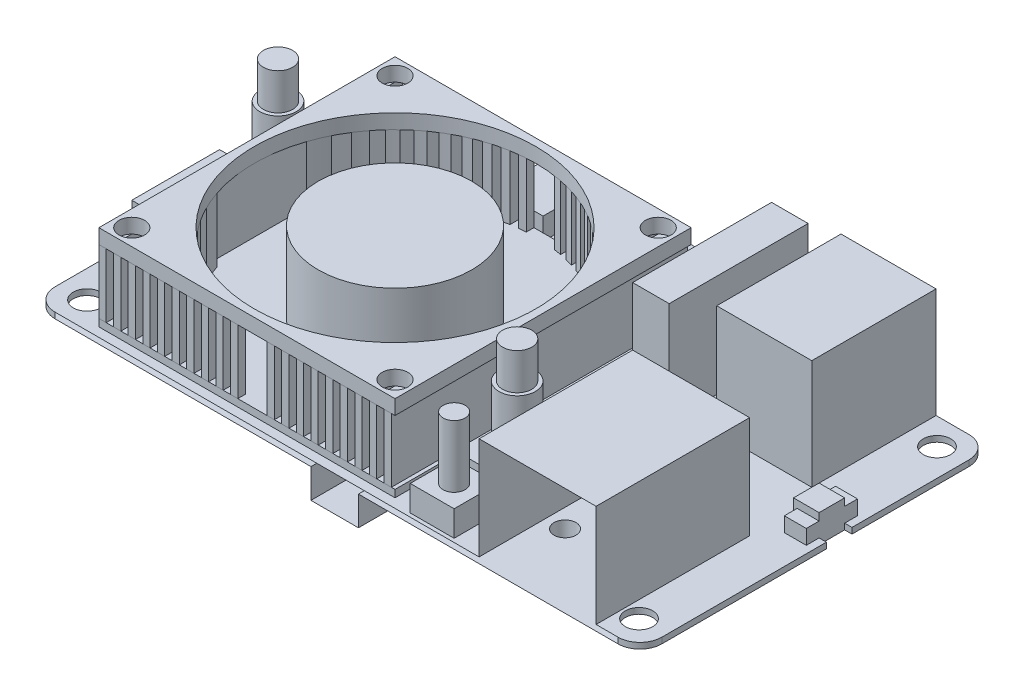
from build123d import *

# Parameters (mm, degrees)
SKETCH1_W                      = 83
SKETCH1_H                      = 48
SKETCH1_R                      = 1.875
BOSS_EXTRUDE1_DEPTH            = 0.8
FILLET1_R                      = 3
BOSS_EXTRUDE2_START            = 11
SKETCH2_R                      = 1.75
SKETCH2_R_2                    = 19.25
BOSS_EXTRUDE2_DEPTH            = 2
SKETCH2_3_W                    = 13
SKETCH2_3_H                    = 17
BOSS_EXTRUDE3_DEPTH            = 15
SKETCH2_4_W                    = 16
SKETCH2_4_H                    = 21
BOSS_EXTRUDE4_DEPTH            = 14
SKETCH2_5_W                    = 5
SKETCH2_5_H                    = 19
BOSS_EXTRUDE5_DEPTH            = 14
SKETCH2_6_R                    = 1.5
BOSS_EXTRUDE6_DEPTH            = 12
SKETCH2_7_W                    = 6
SKETCH2_7_H                    = 6
SKETCH2_7_R                    = 1.5
BOSS_EXTRUDE7_DEPTH            = 3.5
SKETCH2_8_W                    = 7
SKETCH2_8_H                    = 4.25
SKETCH2_8_H_2                  = 0.75
BOSS_EXTRUDE8_DEPTH            = 2.5
SKETCH2_9_W                    = 6.5
SKETCH2_9_H                    = 6.25
SKETCH2_9_H_2                  = 0.75
BOSS_EXTRUDE9_DEPTH            = 3
SKETCH2_10_W                   = 5
SKETCH2_10_H                   = 7.5
BOSS_EXTRUDE10_DEPTH           = 3.5
BOSS_EXTRUDE11_START           = 1.25
BOSS_EXTRUDE11_DEPTH           = 1
BOSS_EXTRUDE12_START           = 2.25
SKETCH2_12_R                   = 2.5
SKETCH2_12_R_2                 = 2
BOSS_EXTRUDE12_DEPTH           = 9
BOSS_EXTRUDE14_START           = 2.25
SKETCH2_13_R                   = 2
BOSS_EXTRUDE14_DEPTH           = 14
BOSS_EXTRUDE15_DEPTH           = 3
SKETCH2_15_W                   = 1
SKETCH2_15_H                   = 3.5
CUT_EXTRUDE1_DEPTH             = 3
SKETCH2_16_W                   = 3
SKETCH2_16_H                   = 1.75
BOSS_EXTRUDE16_DEPTH           = 2
SKETCH2_17_W                   = 2
SKETCH2_17_H                   = 1.75
BOSS_EXTRUDE17_DEPTH           = 2
BOSS_EXTRUDE18_DEPTH           = 6
SKETCH2_19_W                   = 5.06789321
SKETCH2_19_H                   = 12
BOSS_EXTRUDE19_DEPTH           = 5.5
CHAMFER1_SIZE                  = 1
BOSS_EXTRUDE23_DEPTH           = 8.75
BOSS_EXTRUDE23_2_DEPTH         = 8.75
BOSS_EXTRUDE23_3_DEPTH         = 8.75
BOSS_EXTRUDE23_4_DEPTH         = 8.75
BOSS_EXTRUDE23_5_DEPTH         = 8.75
BOSS_EXTRUDE23_6_DEPTH         = 8.75
BOSS_EXTRUDE23_7_DEPTH         = 8.75
BOSS_EXTRUDE23_8_DEPTH         = 8.75
BOSS_EXTRUDE23_9_DEPTH         = 8.75
BOSS_EXTRUDE23_10_DEPTH        = 8.75
BOSS_EXTRUDE23_11_DEPTH        = 8.75
BOSS_EXTRUDE23_12_DEPTH        = 8.75
BOSS_EXTRUDE23_13_DEPTH        = 8.75
BOSS_EXTRUDE23_14_DEPTH        = 8.75
BOSS_EXTRUDE23_15_DEPTH        = 8.75
BOSS_EXTRUDE23_16_DEPTH        = 8.75
BOSS_EXTRUDE23_17_DEPTH        = 8.75
BOSS_EXTRUDE23_18_DEPTH        = 8.75
BOSS_EXTRUDE23_19_DEPTH        = 8.75
BOSS_EXTRUDE23_20_DEPTH        = 8.75
BOSS_EXTRUDE23_21_DEPTH        = 8.75
BOSS_EXTRUDE23_22_DEPTH        = 8.75
BOSS_EXTRUDE23_23_DEPTH        = 8.75
BOSS_EXTRUDE23_24_DEPTH        = 8.75
BOSS_EXTRUDE23_25_DEPTH        = 8.75
BOSS_EXTRUDE23_26_DEPTH        = 8.75
BOSS_EXTRUDE23_27_DEPTH        = 8.75
BOSS_EXTRUDE23_28_DEPTH        = 8.75
BOSS_EXTRUDE23_29_DEPTH        = 8.75
BOSS_EXTRUDE23_30_DEPTH        = 8.75
BOSS_EXTRUDE23_31_DEPTH        = 8.75
BOSS_EXTRUDE23_32_DEPTH        = 8.75
BOSS_EXTRUDE23_33_DEPTH        = 8.75
BOSS_EXTRUDE23_34_DEPTH        = 8.75
BOSS_EXTRUDE23_35_DEPTH        = 8.75
BOSS_EXTRUDE23_36_DEPTH        = 8.75
BOSS_EXTRUDE24_START           = 2.25
SKETCH2_20_R                   = 10.5
BOSS_EXTRUDE24_DEPTH           = 11
SKETCH4_W                      = 4.5
SKETCH4_H                      = 8.5
BOSS_EXTRUDE25_DEPTH           = 4.5
SKETCH4_3_W                    = 11
SKETCH4_3_H                    = 5
BOSS_EXTRUDE26_DEPTH           = 3
SKETCH4_4_W                    = 11
SKETCH4_4_H                    = 13
BOSS_EXTRUDE27_DEPTH           = 2.5
SKETCH4_5_W                    = 13
SKETCH4_5_H                    = 18
SKETCH4_5_W_2                  = 11
SKETCH4_5_H_2                  = 13
BOSS_EXTRUDE28_DEPTH           = 2
SKETCH4_6_W                    = 6.5
SKETCH4_6_H                    = 13
BOSS_EXTRUDE29_DEPTH           = 4
SKETCH4_7_R                    = 1.5
BOSS_EXTRUDE30_DEPTH           = 4
BOSS_EXTRUDE30_DRAFT           = 5
BOSS_EXTRUDE30_PROFILE_2_DEPTH = 4
BOSS_EXTRUDE30_PROFILE_2_DRAFT = 5
SKETCH4_8_R                    = 1.5
BOSS_EXTRUDE31_DEPTH           = 2
BOSS_EXTRUDE31_DRAFT           = 5
BOSS_EXTRUDE31_PROFILE_2_DEPTH = 2
BOSS_EXTRUDE31_PROFILE_2_DRAFT = 5


with BuildPart() as part:
    # Sketch1 → Boss-Extrude1 (new body)
    with BuildSketch(Plane(origin=(0, 0, 0), x_dir=(1, 0, 0), z_dir=(0, 1, 0))):
        with Locations((-41.5, 24)):
            Rectangle(SKETCH1_W, SKETCH1_H)
        with Locations(Location((-79.25, 44.375, 0), (0, 0, 270))):
            Circle(SKETCH1_R, mode=Mode.SUBTRACT)
        with Locations(Location((-79.25, 3.625, 0), (0, 0, 270))):
            Circle(SKETCH1_R, mode=Mode.SUBTRACT)
        with Locations(Location((-3.75, 44.375, 0), (0, 0, 270))):
            Circle(SKETCH1_R, mode=Mode.SUBTRACT)
        with Locations(Location((-3.75, 3.625, 0), (0, 0, 270))):
            Circle(SKETCH1_R, mode=Mode.SUBTRACT)
    extrude(amount=BOSS_EXTRUDE1_DEPTH)

    # Fillet1
    fillet1_edges = [part.edges().sort_by_distance(p)[0] for p in [
        (0, 0.4, 0),
        (-83, 0.4, 0),
        (-83, 0.4, -48),
        (0, 0.4, -48),
    ]]
    fillet(fillet1_edges, radius=FILLET1_R)

    # Sketch2<3> → Boss-Extrude3 (add)
    with BuildSketch(Plane(origin=(0, 0.8, 0), x_dir=(1, 0, 0), z_dir=(0, 1, 0))):
        with Locations((-14, 39.5)):
            Rectangle(SKETCH2_3_W, SKETCH2_3_H)
    extrude(amount=BOSS_EXTRUDE3_DEPTH)

    # Sketch2<4> → Boss-Extrude4 (add)
    with BuildSketch(Plane(origin=(0, 0.8, 0), x_dir=(1, 0, 0), z_dir=(0, 1, 0))):
        with Locations((-14, 10.5)):
            Rectangle(SKETCH2_4_W, SKETCH2_4_H)
    extrude(amount=BOSS_EXTRUDE4_DEPTH)

    # Sketch2<5> → Boss-Extrude5 (add)
    with BuildSketch(Plane(origin=(0, 0.8, 0), x_dir=(1, 0, 0), z_dir=(0, 1, 0))):
        with Locations((-27.5, 38.5)):
            Rectangle(SKETCH2_5_W, SKETCH2_5_H)
    extrude(amount=BOSS_EXTRUDE5_DEPTH)

    # Sketch2<6> → Boss-Extrude6 (add)
    with BuildSketch(Plane(origin=(0, 0.8, 0), x_dir=(1, 0, 0), z_dir=(0, 1, 0))):
        with Locations(Location((-28.917074657, 3.5, 0), (0, 0, 90))):
            Circle(SKETCH2_6_R)
    extrude(amount=BOSS_EXTRUDE6_DEPTH)

    # Sketch2<7> → Boss-Extrude7 (add)
    with BuildSketch(Plane(origin=(0, 0.8, 0), x_dir=(1, 0, 0), z_dir=(0, 1, 0))):
        with Locations((-28.917074657, 3.5)):
            Rectangle(SKETCH2_7_W, SKETCH2_7_H)
        with Locations(Location((-28.917074657, 3.5, 0), (0, 0, 270))):
            Circle(SKETCH2_7_R, mode=Mode.SUBTRACT)
    extrude(amount=BOSS_EXTRUDE7_DEPTH)

    # Sketch2<8> → Boss-Extrude8 (add)
    with BuildSketch(Plane(origin=(0, 0.8, 0), x_dir=(1, 0, 0), z_dir=(0, 1, 0))):
        with Locations((-72, 45.875)):
            Rectangle(SKETCH2_8_W, SKETCH2_8_H)
        with Locations((-72, 48.375)):
            Rectangle(SKETCH2_8_W, SKETCH2_8_H_2)
    extrude(amount=BOSS_EXTRUDE8_DEPTH)

    # Sketch2<9> → Boss-Extrude9 (add)
    with BuildSketch(Plane(origin=(0, 0.8, 0), x_dir=(1, 0, 0), z_dir=(0, 1, 0))):
        with Locations((-58.25, 44.875)):
            Rectangle(SKETCH2_9_W, SKETCH2_9_H)
        with Locations((-58.25, 48.375)):
            Rectangle(SKETCH2_9_W, SKETCH2_9_H_2)
    extrude(amount=BOSS_EXTRUDE9_DEPTH)

    # Sketch2<10> → Boss-Extrude10 (add)
    with BuildSketch(Plane(origin=(0, 0.8, 0), x_dir=(1, 0, 0), z_dir=(0, 1, 0))):
        with Locations((-39.5, 44.25)):
            Rectangle(SKETCH2_10_W, SKETCH2_10_H)
    extrude(amount=BOSS_EXTRUDE10_DEPTH)

    # Sketch2<11> → Boss-Extrude11 (add)
    with BuildSketch(Plane(origin=(0, 0.8, 0), x_dir=(1, 0, 0), z_dir=(0, 1, 0)).offset(BOSS_EXTRUDE11_START)):
        with BuildLine():
            Line((-74, 40.5), (-74, 32.5))
            Line((-74, 32.5), (-78.5, 32.5))
            ThreePointArc((-78.5, 32.5), (-82, 29), (-78.5, 25.5))
            Line((-78.5, 25.5), (-74, 25.5))
            Line((-74, 25.5), (-74, 0))
            Line((-74, 0), (-33.5, 0))
            Line((-33.5, 0), (-33.5, 8.705630347))
            Line((-33.5, 8.705630347), (-29, 8.705630347))
            ThreePointArc((-29, 8.705630347), (-25.5, 12.205630347), (-29, 15.705630347))
            Line((-29, 15.705630347), (-33.5, 15.705630347))
            Line((-33.5, 15.705630347), (-33.5, 40.5))
            Line((-33.5, 40.5), (-74, 40.5))
        make_face()
    extrude(amount=BOSS_EXTRUDE11_DEPTH)

    # Sketch2<12> → Boss-Extrude12 (add)
    # profile 1 of 2: a face of its own
    with BuildSketch(Plane(origin=(0, 0.8, 0), x_dir=(1, 0, 0), z_dir=(0, 1, 0)).offset(BOSS_EXTRUDE12_START)):
        with Locations(Location((-78.5, 29, 0), (0, 0, 270))):
            Circle(SKETCH2_12_R)
        with Locations(Location((-78.5, 29, 0), (0, 0, 270))):
            Circle(SKETCH2_12_R_2, mode=Mode.SUBTRACT)
    # profile 2 of 2: a face of its own
    with BuildSketch(Plane(origin=(0, 0.8, 0), x_dir=(1, 0, 0), z_dir=(0, 1, 0)).offset(BOSS_EXTRUDE12_START)):
        with Locations(Location((-29, 12.205630347, 0), (0, 0, 270))):
            Circle(SKETCH2_12_R)
        with Locations(Location((-29, 12.205630347, 0), (0, 0, 270))):
            Circle(SKETCH2_12_R_2, mode=Mode.SUBTRACT)
    extrude(amount=BOSS_EXTRUDE12_DEPTH)

    # Sketch2<13> → Boss-Extrude14 (add)
    with BuildSketch(Plane(origin=(0, 0.8, 0), x_dir=(1, 0, 0), z_dir=(0, 1, 0)).offset(BOSS_EXTRUDE14_START)):
        with Locations(Location((-78.5, 29, 0), (0, 0, 270))):
            Circle(SKETCH2_13_R)
        with Locations(Location((-29, 12.205630347, 0), (0, 0, 270))):
            Circle(SKETCH2_13_R)
    extrude(amount=BOSS_EXTRUDE14_DEPTH)

    # Sketch2<14> → Boss-Extrude15 (add)
    with BuildSketch(Plane(origin=(0, 0.8, 0), x_dir=(1, 0, 0), z_dir=(0, 1, 0))):
        Polygon((-1, 25.5), (-1, 29), (-4, 29), (-4.5, 29), (-4.5, 25.5), (-4, 25.5), align=None)
    extrude(amount=BOSS_EXTRUDE15_DEPTH)

    # Sketch2<15> → Cut-Extrude1 (cut)
    with BuildSketch(Plane(origin=(0, 0.8, 0), x_dir=(1, 0, 0), z_dir=(0, 1, 0))):
        with Locations((-0.5, 27.25)):
            Rectangle(SKETCH2_15_W, SKETCH2_15_H)
    extrude(amount=-CUT_EXTRUDE1_DEPTH, mode=Mode.SUBTRACT)

    # Sketch2<16> → Boss-Extrude16 (add)
    with BuildSketch(Plane(origin=(0, 0.8, 0), x_dir=(1, 0, 0), z_dir=(0, 1, 0))):
        with Locations((-2.5, 29.875)):
            Rectangle(SKETCH2_16_W, SKETCH2_16_H)
        with Locations((-2.5, 24.625)):
            Rectangle(SKETCH2_16_W, SKETCH2_16_H)
    extrude(amount=BOSS_EXTRUDE16_DEPTH)

    # Sketch2<17> → Boss-Extrude17 (add)
    with BuildSketch(Plane(origin=(0, 0.8, 0), x_dir=(1, 0, 0), z_dir=(0, 1, 0))):
        Polygon((-27, 22), (-27, 20.25), (-29, 20.25), (-29, 27.25), (-27, 27.25), (-27, 25.5), (-26.5, 25.5), (-26.5, 22), align=None)
        with Locations((-28, 21.125)):
            Rectangle(SKETCH2_17_W, SKETCH2_17_H)
        with Locations((-28, 26.375)):
            Rectangle(SKETCH2_17_W, SKETCH2_17_H)
    extrude(amount=BOSS_EXTRUDE17_DEPTH)

    # Sketch2<18> → Boss-Extrude18 (add)
    with BuildSketch(Plane(origin=(0, 0.8, 0), x_dir=(1, 0, 0), z_dir=(0, 1, 0))):
        Polygon((-27, 25.5), (-29, 25.5), (-29, 22), (-27, 22), (-26.5, 22), (-26.5, 25.5), align=None)
    extrude(amount=BOSS_EXTRUDE18_DEPTH)

    # Sketch2<19> → Boss-Extrude19 (add)
    with BuildSketch(Plane(origin=(0, 0.8, 0), x_dir=(1, 0, 0), z_dir=(0, 1, 0))):
        with Locations((-79.966053395, 19)):
            Rectangle(SKETCH2_19_W, SKETCH2_19_H)
    extrude(amount=BOSS_EXTRUDE19_DEPTH)

    # Chamfer1
    chamfer1_edges = [part.edges().sort_by_distance(p)[0] for p in [
        (-77.43210679, 3.55, -25),
    ]]
    chamfer(chamfer1_edges, length=CHAMFER1_SIZE)

    # Sketch2<20> → Boss-Extrude24 (add)
    with BuildSketch(Plane(origin=(0, 0.8, 0), x_dir=(1, 0, 0), z_dir=(0, 1, 0)).offset(BOSS_EXTRUDE24_START)):
        with Locations(Location((-53.75, 20.25, 0), (0, 0, 270))):
            Circle(SKETCH2_20_R)
    extrude(amount=BOSS_EXTRUDE24_DEPTH)

    # Sketch4 → Boss-Extrude25 (add)
    with BuildSketch(Plane.XZ):
        with Locations((-80.25, -36.75)):
            Rectangle(SKETCH4_W, SKETCH4_H)
    extrude(amount=BOSS_EXTRUDE25_DEPTH)

    # Sketch4<3> → Boss-Extrude26 (add)
    with BuildSketch(Plane.XZ):
        with Locations((-69, -12.5)):
            Rectangle(SKETCH4_3_W, SKETCH4_3_H)
    extrude(amount=BOSS_EXTRUDE26_DEPTH)

    # Sketch4<4> → Boss-Extrude27 (add)
    with BuildSketch(Plane.XZ):
        with Locations((-56.5, -10)):
            Rectangle(SKETCH4_4_W, SKETCH4_4_H)
    extrude(amount=BOSS_EXTRUDE27_DEPTH)

    # Sketch4<5> → Boss-Extrude28 (add)
    with BuildSketch(Plane.XZ):
        with Locations((-56.5, -11)):
            Rectangle(SKETCH4_5_W, SKETCH4_5_H)
        with Locations((-56.5, -10)):
            Rectangle(SKETCH4_5_W_2, SKETCH4_5_H_2, mode=Mode.SUBTRACT)
    extrude(amount=BOSS_EXTRUDE28_DEPTH)

    # Sketch4<6> → Boss-Extrude29 (add)
    with BuildSketch(Plane.XZ):
        with Locations((-41.75, -6.5)):
            Rectangle(SKETCH4_6_W, SKETCH4_6_H)
    extrude(amount=BOSS_EXTRUDE29_DEPTH)


with BuildPart() as body_2:
    # Sketch2 → Boss-Extrude2 (new body)
    with BuildSketch(Plane(origin=(0, 0.8, 0), x_dir=(1, 0, 0), z_dir=(0, 1, 0)).offset(BOSS_EXTRUDE2_START)):
        Polygon((-42, 40.5), (-74, 40.5), (-74, 32.5), (-74, 25.5), (-74, 0), (-33.5, 0), (-33.5, 8.705630347), (-33.5, 15.705630347), (-33.5, 40.5), (-37, 40.5), align=None)
        with Locations(Location((-71.75, 2.25, 0), (0, 0, 270))):
            Circle(SKETCH2_R, mode=Mode.SUBTRACT)
        with Locations(Location((-53.75, 20.25, 0), (0, 0, 270))):
            Circle(SKETCH2_R_2, mode=Mode.SUBTRACT)
        with Locations(Location((-35.75, 2.25, 0), (0, 0, 270))):
            Circle(SKETCH2_R, mode=Mode.SUBTRACT)
        with Locations(Location((-71.75, 38.25, 0), (0, 0, 270))):
            Circle(SKETCH2_R, mode=Mode.SUBTRACT)
        with Locations(Location((-35.75, 38.25, 0), (0, 0, 270))):
            Circle(SKETCH2_R, mode=Mode.SUBTRACT)
    extrude(amount=BOSS_EXTRUDE2_DEPTH)


with BuildPart() as body_3:
    # Sketch3 → Boss-Extrude23 (new body)
    with BuildSketch(Plane(origin=(0, 3.05, 0), x_dir=(1, 0, 0), z_dir=(0, 1, 0))):
        Polygon((-74, 40.5), (-74, 32.5), (-74, 25.5), (-74, 0), (-73, 0), (-73, 20.25), (-73, 25.5), (-73, 32.5), (-73, 40.5), align=None)
    extrude(amount=BOSS_EXTRUDE23_DEPTH)


with BuildPart() as body_4:
    # Sketch3 → Boss-Extrude23 2 (new body)
    with BuildSketch(Plane(origin=(0, 3.05, 0), x_dir=(1, 0, 0), z_dir=(0, 1, 0))):
        with BuildLine():
            Line((-72, 14.126275643), (-72, 0))
            Line((-72, 0), (-71, 0))
            Line((-71, 0), (-71, 11.705996255))
            ThreePointArc((-71, 11.705996255), (-71.541203952, 12.899111488), (-72, 14.126275643))
        make_face()
    extrude(amount=BOSS_EXTRUDE23_2_DEPTH)


with BuildPart() as body_5:
    # Sketch3 → Boss-Extrude23 3 (new body)
    with BuildSketch(Plane(origin=(0, 3.05, 0), x_dir=(1, 0, 0), z_dir=(0, 1, 0))):
        with BuildLine():
            Line((-70, 9.93011628), (-70, 0))
            Line((-70, 0), (-69, 0))
            Line((-69, 0), (-69, 8.502659876))
            ThreePointArc((-69, 8.502659876), (-69.516163387, 9.205064869), (-70, 9.93011628))
        make_face()
    extrude(amount=BOSS_EXTRUDE23_3_DEPTH)


with BuildPart() as body_6:
    # Sketch3 → Boss-Extrude23 4 (new body)
    with BuildSketch(Plane(origin=(0, 3.05, 0), x_dir=(1, 0, 0), z_dir=(0, 1, 0))):
        with BuildLine():
            Line((-68, 7.307820894), (-68, 0))
            Line((-68, 0), (-67, 0))
            Line((-67, 0), (-67, 6.285759956))
            ThreePointArc((-67, 6.285759956), (-67.509493164, 6.787502169), (-68, 7.307820894))
        make_face()
    extrude(amount=BOSS_EXTRUDE23_4_DEPTH)


with BuildPart() as body_7:
    # Sketch3 → Boss-Extrude23 5 (new body)
    with BuildSketch(Plane(origin=(0, 3.05, 0), x_dir=(1, 0, 0), z_dir=(0, 1, 0))):
        with BuildLine():
            Line((-66, 5.400757595), (-66, 0))
            Line((-66, 0), (-65, 0))
            Line((-65, 0), (-65, 4.629500648))
            ThreePointArc((-65, 4.629500648), (-65.506326353, 5.006926469), (-66, 5.400757595))
        make_face()
    extrude(amount=BOSS_EXTRUDE23_5_DEPTH)


with BuildPart() as body_8:
    # Sketch3 → Boss-Extrude23 6 (new body)
    with BuildSketch(Plane(origin=(0, 3.05, 0), x_dir=(1, 0, 0), z_dir=(0, 1, 0))):
        with BuildLine():
            Line((-64, 3.955829263), (-64, 0))
            Line((-64, 0), (-63, 0))
            Line((-63, 0), (-63, 3.368056984))
            ThreePointArc((-63, 3.368056984), (-63.504428177, 3.654409292), (-64, 3.955829263))
        make_face()
    extrude(amount=BOSS_EXTRUDE23_6_DEPTH)


with BuildPart() as body_9:
    # Sketch3 → Boss-Extrude23 7 (new body)
    with BuildSketch(Plane(origin=(0, 3.05, 0), x_dir=(1, 0, 0), z_dir=(0, 1, 0))):
        with BuildLine():
            Line((-62, 2.857472869), (-62, 0))
            Line((-62, 0), (-61, 0))
            Line((-61, 0), (-61, 2.4174455))
            ThreePointArc((-61, 2.4174455), (-61.50312234, 2.630363398), (-62, 2.857472869))
        make_face()
    extrude(amount=BOSS_EXTRUDE23_7_DEPTH)


with BuildPart() as body_10:
    # Sketch3 → Boss-Extrude23 8 (new body)
    with BuildSketch(Plane(origin=(0, 3.05, 0), x_dir=(1, 0, 0), z_dir=(0, 1, 0))):
        with BuildLine():
            Line((-60, 2.042858544), (-60, 0))
            Line((-60, 0), (-59, 0))
            Line((-59, 0), (-59, 1.729740823))
            ThreePointArc((-59, 1.729740823), (-59.502130968, 1.879494037), (-60, 2.042858544))
        make_face()
    extrude(amount=BOSS_EXTRUDE23_8_DEPTH)


with BuildPart() as body_11:
    # Sketch3 → Boss-Extrude23 9 (new body)
    with BuildSketch(Plane(origin=(0, 3.05, 0), x_dir=(1, 0, 0), z_dir=(0, 1, 0))):
        with BuildLine():
            Line((-58, 1.475016644), (-58, 0))
            Line((-58, 0), (-57, 0))
            Line((-57, 0), (-57, 1.276334039))
            ThreePointArc((-57, 1.276334039), (-57.501315595, 1.36905375), (-58, 1.475016644))
        make_face()
    extrude(amount=BOSS_EXTRUDE23_9_DEPTH)


with BuildPart() as body_12:
    # Sketch3 → Boss-Extrude23 10 (new body)
    with BuildSketch(Plane(origin=(0, 3.05, 0), x_dir=(1, 0, 0), z_dir=(0, 1, 0))):
        with BuildLine():
            Line((-56, 1.131945706), (-56, 0))
            Line((-56, 0), (-55, 0))
            Line((-55, 0), (-55, 1.040627288))
            ThreePointArc((-55, 1.040627288), (-55.500595545, 1.079764862), (-56, 1.131945706))
        make_face()
    extrude(amount=BOSS_EXTRUDE23_10_DEPTH)


with BuildPart() as body_13:
    # Sketch3 → Boss-Extrude23 11 (new body)
    with BuildSketch(Plane(origin=(0, 3.05, 0), x_dir=(1, 0, 0), z_dir=(0, 1, 0))):
        with BuildLine():
            Line((-71, 40.5), (-72, 40.5))
            Line((-72, 40.5), (-72, 32.5))
            Line((-72, 32.5), (-72, 26.373724357))
            ThreePointArc((-72, 26.373724357), (-71.541203952, 27.600888512), (-71, 28.794003745))
            Line((-71, 28.794003745), (-71, 32.5))
            Line((-71, 32.5), (-71, 40.5))
        make_face()
    extrude(amount=BOSS_EXTRUDE23_11_DEPTH)


with BuildPart() as body_14:
    # Sketch3 → Boss-Extrude23 12 (new body)
    with BuildSketch(Plane(origin=(0, 3.05, 0), x_dir=(1, 0, 0), z_dir=(0, 1, 0))):
        with BuildLine():
            Line((-69, 40.5), (-70, 40.5))
            Line((-70, 40.5), (-70, 32.5))
            Line((-70, 32.5), (-70, 30.56988372))
            ThreePointArc((-70, 30.56988372), (-69.516163387, 31.294935131), (-69, 31.997340124))
            Line((-69, 31.997340124), (-69, 32.5))
            Line((-69, 32.5), (-69, 40.5))
        make_face()
    extrude(amount=BOSS_EXTRUDE23_12_DEPTH)


with BuildPart() as body_15:
    # Sketch3 → Boss-Extrude23 13 (new body)
    with BuildSketch(Plane(origin=(0, 3.05, 0), x_dir=(1, 0, 0), z_dir=(0, 1, 0))):
        with BuildLine():
            Line((-67, 40.5), (-68, 40.5))
            Line((-68, 40.5), (-68, 33.192179106))
            ThreePointArc((-68, 33.192179106), (-67.509493164, 33.712497831), (-67, 34.214240044))
            Line((-67, 34.214240044), (-67, 40.5))
        make_face()
    extrude(amount=BOSS_EXTRUDE23_13_DEPTH)


with BuildPart() as body_16:
    # Sketch3 → Boss-Extrude23 14 (new body)
    with BuildSketch(Plane(origin=(0, 3.05, 0), x_dir=(1, 0, 0), z_dir=(0, 1, 0))):
        with BuildLine():
            Line((-65, 40.5), (-66, 40.5))
            Line((-66, 40.5), (-66, 35.099242405))
            ThreePointArc((-66, 35.099242405), (-65.506326353, 35.493073531), (-65, 35.870499352))
            Line((-65, 35.870499352), (-65, 40.5))
        make_face()
    extrude(amount=BOSS_EXTRUDE23_14_DEPTH)


with BuildPart() as body_17:
    # Sketch3 → Boss-Extrude23 15 (new body)
    with BuildSketch(Plane(origin=(0, 3.05, 0), x_dir=(1, 0, 0), z_dir=(0, 1, 0))):
        with BuildLine():
            Line((-63, 40.5), (-64, 40.5))
            Line((-64, 40.5), (-64, 36.544170737))
            ThreePointArc((-64, 36.544170737), (-63.504428177, 36.845590708), (-63, 37.131943016))
            Line((-63, 37.131943016), (-63, 40.5))
        make_face()
    extrude(amount=BOSS_EXTRUDE23_15_DEPTH)


with BuildPart() as body_18:
    # Sketch3 → Boss-Extrude23 16 (new body)
    with BuildSketch(Plane(origin=(0, 3.05, 0), x_dir=(1, 0, 0), z_dir=(0, 1, 0))):
        with BuildLine():
            Line((-61, 40.5), (-62, 40.5))
            Line((-62, 40.5), (-62, 37.642527131))
            ThreePointArc((-62, 37.642527131), (-61.50312234, 37.869636602), (-61, 38.0825545))
            Line((-61, 38.0825545), (-61, 40.5))
        make_face()
    extrude(amount=BOSS_EXTRUDE23_16_DEPTH)


with BuildPart() as body_19:
    # Sketch3 → Boss-Extrude23 17 (new body)
    with BuildSketch(Plane(origin=(0, 3.05, 0), x_dir=(1, 0, 0), z_dir=(0, 1, 0))):
        with BuildLine():
            Line((-59, 40.5), (-60, 40.5))
            Line((-60, 40.5), (-60, 38.457141456))
            ThreePointArc((-60, 38.457141456), (-59.502130968, 38.620505963), (-59, 38.770259177))
            Line((-59, 38.770259177), (-59, 40.5))
        make_face()
    extrude(amount=BOSS_EXTRUDE23_17_DEPTH)


with BuildPart() as body_20:
    # Sketch3 → Boss-Extrude23 18 (new body)
    with BuildSketch(Plane(origin=(0, 3.05, 0), x_dir=(1, 0, 0), z_dir=(0, 1, 0))):
        with BuildLine():
            Line((-57, 40.5), (-58, 40.5))
            Line((-58, 40.5), (-58, 39.024983356))
            ThreePointArc((-58, 39.024983356), (-57.501315595, 39.13094625), (-57, 39.223665961))
            Line((-57, 39.223665961), (-57, 40.5))
        make_face()
    extrude(amount=BOSS_EXTRUDE23_18_DEPTH)


with BuildPart() as body_21:
    # Sketch3 → Boss-Extrude23 19 (new body)
    with BuildSketch(Plane(origin=(0, 3.05, 0), x_dir=(1, 0, 0), z_dir=(0, 1, 0))):
        with BuildLine():
            Line((-55, 40.5), (-56, 40.5))
            Line((-56, 40.5), (-56, 39.368054294))
            ThreePointArc((-56, 39.368054294), (-55.500595545, 39.420235138), (-55, 39.459372712))
            Line((-55, 39.459372712), (-55, 40.5))
        make_face()
    extrude(amount=BOSS_EXTRUDE23_19_DEPTH)


with BuildPart() as body_22:
    # Sketch3 → Boss-Extrude23 20 (new body)
    with BuildSketch(Plane(origin=(0, 3.05, 0), x_dir=(1, 0, 0), z_dir=(0, 1, 0))):
        with BuildLine():
            Line((-51, 1.197441117), (-51, 0))
            Line((-51, 0), (-50, 0))
            Line((-50, 0), (-50, 1.368792412))
            ThreePointArc((-50, 1.368792412), (-50.498870917, 1.276527474), (-51, 1.197441117))
        make_face()
    extrude(amount=BOSS_EXTRUDE23_20_DEPTH)


with BuildPart() as body_23:
    # Sketch3 → Boss-Extrude23 21 (new body)
    with BuildSketch(Plane(origin=(0, 3.05, 0), x_dir=(1, 0, 0), z_dir=(0, 1, 0))):
        with BuildLine():
            Line((-49, 1.595241894), (-49, 0))
            Line((-49, 0), (-48, 0))
            Line((-48, 0), (-48, 1.878826929))
            ThreePointArc((-48, 1.878826929), (-48.498085576, 1.730283618), (-49, 1.595241894))
        make_face()
    extrude(amount=BOSS_EXTRUDE23_21_DEPTH)


with BuildPart() as body_24:
    # Sketch3 → Boss-Extrude23 22 (new body)
    with BuildSketch(Plane(origin=(0, 3.05, 0), x_dir=(1, 0, 0), z_dir=(0, 1, 0))):
        with BuildLine():
            Line((-47, 2.222243623), (-47, 0))
            Line((-47, 0), (-46, 0))
            Line((-46, 0), (-46, 2.628989813))
            ThreePointArc((-46, 2.628989813), (-46.497148105, 2.418605232), (-47, 2.222243623))
        make_face()
    extrude(amount=BOSS_EXTRUDE23_22_DEPTH)


with BuildPart() as body_25:
    # Sketch3 → Boss-Extrude23 23 (new body)
    with BuildSketch(Plane(origin=(0, 3.05, 0), x_dir=(1, 0, 0), z_dir=(0, 1, 0))):
        with BuildLine():
            Line((-45, 3.103571801), (-45, 0))
            Line((-45, 0), (-44, 0))
            Line((-44, 0), (-44, 3.651807327))
            ThreePointArc((-44, 3.651807327), (-44.49593924, 3.370282602), (-45, 3.103571801))
        make_face()
    extrude(amount=BOSS_EXTRUDE23_23_DEPTH)


with BuildPart() as body_26:
    # Sketch3 → Boss-Extrude23 24 (new body)
    with BuildSketch(Plane(origin=(0, 3.05, 0), x_dir=(1, 0, 0), z_dir=(0, 1, 0))):
        with BuildLine():
            Line((-43, 4.281280577), (-43, 0))
            Line((-43, 0), (-42, 0))
            Line((-42, 0), (-42, 5.002049318))
            ThreePointArc((-42, 5.002049318), (-42.494229174, 4.63365846), (-43, 4.281280577))
        make_face()
    extrude(amount=BOSS_EXTRUDE23_24_DEPTH)


with BuildPart() as body_27:
    # Sketch3 → Boss-Extrude23 25 (new body)
    with BuildSketch(Plane(origin=(0, 3.05, 0), x_dir=(1, 0, 0), z_dir=(0, 1, 0))):
        with BuildLine():
            Line((-41, 5.827794898), (-41, 0))
            Line((-41, 0), (-40, 0))
            Line((-40, 0), (-40, 6.777806415))
            ThreePointArc((-40, 6.777806415), (-40.491488377, 6.293841161), (-41, 5.827794898))
        make_face()
    extrude(amount=BOSS_EXTRUDE23_25_DEPTH)


with BuildPart() as body_28:
    # Sketch3 → Boss-Extrude23 26 (new body)
    with BuildSketch(Plane(origin=(0, 3.05, 0), x_dir=(1, 0, 0), z_dir=(0, 1, 0))):
        with BuildLine():
            Line((-39, 7.880683123), (-39, 0))
            Line((-39, 0), (-38, 0))
            Line((-38, 0), (-38, 9.182028189))
            ThreePointArc((-38, 9.182028189), (-38.486125173, 8.520693744), (-39, 7.880683123))
        make_face()
    extrude(amount=BOSS_EXTRUDE23_26_DEPTH)


with BuildPart() as body_29:
    # Sketch3 → Boss-Extrude23 27 (new body)
    with BuildSketch(Plane(origin=(0, 3.05, 0), x_dir=(1, 0, 0), z_dir=(0, 1, 0))):
        with BuildLine():
            Line((-37, 10.763167019), (-37, 0))
            Line((-37, 0), (-36, 0))
            Line((-36, 0), (-36, 12.800167787))
            ThreePointArc((-36, 12.800167787), (-36.469958246, 11.76691937), (-37, 10.763167019))
        make_face()
    extrude(amount=BOSS_EXTRUDE23_27_DEPTH)


with BuildPart() as body_30:
    # Sketch3 → Boss-Extrude23 28 (new body)
    with BuildSketch(Plane(origin=(0, 3.05, 0), x_dir=(1, 0, 0), z_dir=(0, 1, 0))):
        with BuildLine():
            Line((-34, 40.5), (-35, 40.5))
            Line((-35, 40.5), (-35, 32.5))
            Line((-35, 32.5), (-35, 25.5))
            Line((-35, 25.5), (-35, 24.608898944))
            ThreePointArc((-35, 24.608898944), (-34.625408501, 22.443741097), (-34.5, 20.25))
            ThreePointArc((-34.5, 20.25), (-34.625408501, 18.056258903), (-35, 15.891101056))
            Line((-35, 15.891101056), (-35, 0))
            Line((-35, 0), (-34, 0))
            Line((-34, 0), (-34, 25.5))
            Line((-34, 25.5), (-34, 32.5))
            Line((-34, 32.5), (-34, 40.5))
        make_face()
    extrude(amount=BOSS_EXTRUDE23_28_DEPTH)


with BuildPart() as body_31:
    # Sketch3 → Boss-Extrude23 29 (new body)
    with BuildSketch(Plane(origin=(0, 3.05, 0), x_dir=(1, 0, 0), z_dir=(0, 1, 0))):
        with BuildLine():
            Line((-36, 40.5), (-37, 40.5))
            Line((-37, 40.5), (-37, 32.5))
            Line((-37, 32.5), (-37, 29.736832981))
            ThreePointArc((-37, 29.736832981), (-36.469958246, 28.73308063), (-36, 27.699832213))
            Line((-36, 27.699832213), (-36, 32.5))
            Line((-36, 32.5), (-36, 40.5))
        make_face()
    extrude(amount=BOSS_EXTRUDE23_29_DEPTH)


with BuildPart() as body_32:
    # Sketch3 → Boss-Extrude23 30 (new body)
    with BuildSketch(Plane(origin=(0, 3.05, 0), x_dir=(1, 0, 0), z_dir=(0, 1, 0))):
        with BuildLine():
            Line((-38, 40.5), (-39, 40.5))
            Line((-39, 40.5), (-39, 32.619316877))
            ThreePointArc((-39, 32.619316877), (-38.486125173, 31.979306256), (-38, 31.317971811))
            Line((-38, 31.317971811), (-38, 32.5))
            Line((-38, 32.5), (-38, 40.5))
        make_face()
    extrude(amount=BOSS_EXTRUDE23_30_DEPTH)


with BuildPart() as body_33:
    # Sketch3 → Boss-Extrude23 31 (new body)
    with BuildSketch(Plane(origin=(0, 3.05, 0), x_dir=(1, 0, 0), z_dir=(0, 1, 0))):
        with BuildLine():
            Line((-40, 40.5), (-41, 40.5))
            Line((-41, 40.5), (-41, 34.672205102))
            ThreePointArc((-41, 34.672205102), (-40.491488377, 34.206158839), (-40, 33.722193585))
            Line((-40, 33.722193585), (-40, 40.5))
        make_face()
    extrude(amount=BOSS_EXTRUDE23_31_DEPTH)


with BuildPart() as body_34:
    # Sketch3 → Boss-Extrude23 32 (new body)
    with BuildSketch(Plane(origin=(0, 3.05, 0), x_dir=(1, 0, 0), z_dir=(0, 1, 0))):
        with BuildLine():
            Line((-42, 40.5), (-43, 40.5))
            Line((-43, 40.5), (-43, 36.218719423))
            ThreePointArc((-43, 36.218719423), (-42.494229174, 35.86634154), (-42, 35.497950682))
            Line((-42, 35.497950682), (-42, 40.5))
        make_face()
    extrude(amount=BOSS_EXTRUDE23_32_DEPTH)


with BuildPart() as body_35:
    # Sketch3 → Boss-Extrude23 33 (new body)
    with BuildSketch(Plane(origin=(0, 3.05, 0), x_dir=(1, 0, 0), z_dir=(0, 1, 0))):
        with BuildLine():
            Line((-44, 40.5), (-45, 40.5))
            Line((-45, 40.5), (-45, 37.396428199))
            ThreePointArc((-45, 37.396428199), (-44.49593924, 37.129717398), (-44, 36.848192673))
            Line((-44, 36.848192673), (-44, 40.5))
        make_face()
    extrude(amount=BOSS_EXTRUDE23_33_DEPTH)


with BuildPart() as body_36:
    # Sketch3 → Boss-Extrude23 34 (new body)
    with BuildSketch(Plane(origin=(0, 3.05, 0), x_dir=(1, 0, 0), z_dir=(0, 1, 0))):
        with BuildLine():
            Line((-46, 40.5), (-47, 40.5))
            Line((-47, 40.5), (-47, 38.277756377))
            ThreePointArc((-47, 38.277756377), (-46.497148105, 38.081394768), (-46, 37.871010187))
            Line((-46, 37.871010187), (-46, 40.5))
        make_face()
    extrude(amount=BOSS_EXTRUDE23_34_DEPTH)


with BuildPart() as body_37:
    # Sketch3 → Boss-Extrude23 35 (new body)
    with BuildSketch(Plane(origin=(0, 3.05, 0), x_dir=(1, 0, 0), z_dir=(0, 1, 0))):
        with BuildLine():
            Line((-48, 40.5), (-49, 40.5))
            Line((-49, 40.5), (-49, 38.904758106))
            ThreePointArc((-49, 38.904758106), (-48.498085576, 38.769716382), (-48, 38.621173071))
            Line((-48, 38.621173071), (-48, 40.5))
        make_face()
    extrude(amount=BOSS_EXTRUDE23_35_DEPTH)


with BuildPart() as body_38:
    # Sketch3 → Boss-Extrude23 36 (new body)
    with BuildSketch(Plane(origin=(0, 3.05, 0), x_dir=(1, 0, 0), z_dir=(0, 1, 0))):
        with BuildLine():
            Line((-50, 40.5), (-51, 40.5))
            Line((-51, 40.5), (-51, 39.302558883))
            ThreePointArc((-51, 39.302558883), (-50.498870917, 39.223472526), (-50, 39.131207588))
            Line((-50, 39.131207588), (-50, 40.5))
        make_face()
    extrude(amount=BOSS_EXTRUDE23_36_DEPTH)


with BuildPart() as boss_extrude30_tool:
    # Sketch4<7> → Boss-Extrude30 (with draft: the straight prism first)
    with BuildSketch(Plane.XZ):
        with Locations((-78.5, -29)):
            Circle(SKETCH4_7_R)
    extrude(amount=BOSS_EXTRUDE30_DEPTH)
    # Boss-Extrude30: the draft: its side faces are tilted about the plane it starts from
    boss_extrude30_sides = [boss_extrude30_tool.faces().sort_by_distance(p)[0] for p in [
        (-80, -2, -29),
    ]]
    draft(boss_extrude30_sides, Plane.XZ, BOSS_EXTRUDE30_DRAFT)


with BuildPart() as part_1:
    add(part.part)

    # Boss-Extrude30: add boss_extrude30_tool
    add(boss_extrude30_tool.part)


with BuildPart() as boss_extrude30_profile_2_tool:
    # Sketch4<7> → Boss-Extrude30 profile 2 (with draft: the straight prism first)
    with BuildSketch(Plane.XZ):
        with Locations((-29, -12.205630347)):
            Circle(SKETCH4_7_R)
    extrude(amount=BOSS_EXTRUDE30_PROFILE_2_DEPTH)
    # Boss-Extrude30 profile 2: the draft: its side faces are tilted about the plane it starts from
    boss_extrude30_profile_2_sides = [boss_extrude30_profile_2_tool.faces().sort_by_distance(p)[0] for p in [
        (-30.5, -2, -12.205630347),
    ]]
    draft(boss_extrude30_profile_2_sides, Plane.XZ, BOSS_EXTRUDE30_PROFILE_2_DRAFT)


with BuildPart() as part_2:
    add(part_1.part)

    # Boss-Extrude30 profile 2: add boss_extrude30_profile_2_tool
    add(boss_extrude30_profile_2_tool.part)


with BuildPart() as boss_extrude31_tool:
    # Sketch4<8> → Boss-Extrude31 (with draft: the straight prism first)
    with BuildSketch(Plane.XZ):
        with Locations((-20.25, -10)):
            Circle(SKETCH4_8_R)
    extrude(amount=BOSS_EXTRUDE31_DEPTH)
    # Boss-Extrude31: the draft: its side faces are tilted about the plane it starts from
    boss_extrude31_sides = [boss_extrude31_tool.faces().sort_by_distance(p)[0] for p in [
        (-21.75, -1, -10),
    ]]
    draft(boss_extrude31_sides, Plane.XZ, BOSS_EXTRUDE31_DRAFT)


with BuildPart() as part_3:
    add(part_2.part)

    # Boss-Extrude31: add boss_extrude31_tool
    add(boss_extrude31_tool.part)


with BuildPart() as boss_extrude31_profile_2_tool:
    # Sketch4<8> → Boss-Extrude31 profile 2 (with draft: the straight prism first)
    with BuildSketch(Plane.XZ):
        with Locations((-7.75, -10)):
            Circle(SKETCH4_8_R)
    extrude(amount=BOSS_EXTRUDE31_PROFILE_2_DEPTH)
    # Boss-Extrude31 profile 2: the draft: its side faces are tilted about the plane it starts from
    boss_extrude31_profile_2_sides = [boss_extrude31_profile_2_tool.faces().sort_by_distance(p)[0] for p in [
        (-9.25, -1, -10),
    ]]
    draft(boss_extrude31_profile_2_sides, Plane.XZ, BOSS_EXTRUDE31_PROFILE_2_DRAFT)


with BuildPart() as part_4:
    add(part_3.part)

    # Boss-Extrude31 profile 2: add boss_extrude31_profile_2_tool
    add(boss_extrude31_profile_2_tool.part)


solid = Compound([body_2.part, body_3.part, body_4.part, body_5.part, body_6.part, body_7.part, body_8.part, body_9.part, body_10.part, body_11.part, body_12.part, body_13.part, body_14.part, body_15.part, body_16.part, body_17.part, body_18.part, body_19.part, body_20.part, body_21.part, body_22.part, body_23.part, body_24.part, body_25.part, body_26.part, body_27.part, body_28.part, body_29.part, body_30.part, body_31.part, body_32.part, body_33.part, body_34.part, body_35.part, body_36.part, body_37.part, body_38.part, part_4.part])
